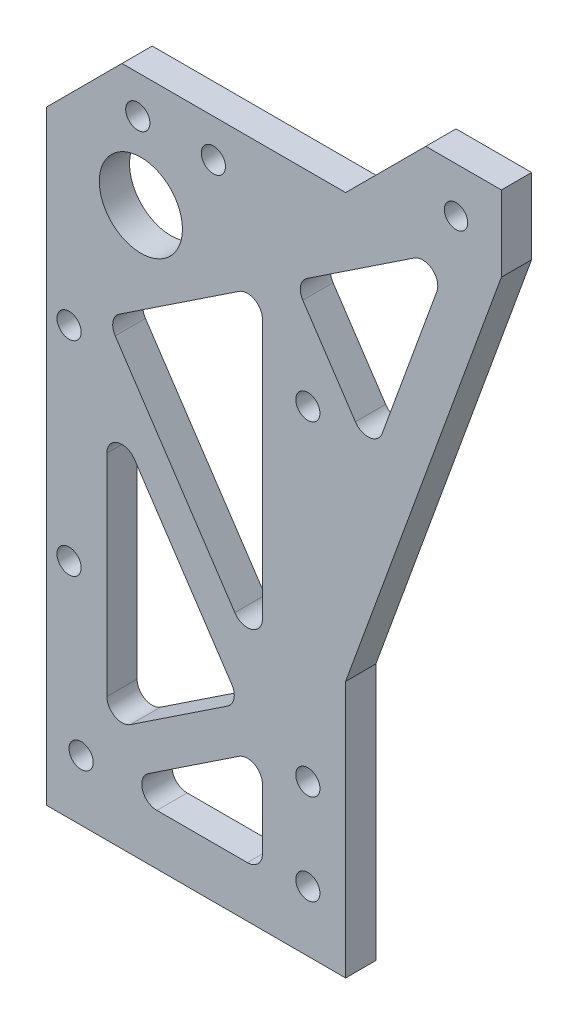
from build123d import *

# Parameters (mm, degrees)
SKETCH_1_R          = 1.6
SKETCH_1_R_2        = 6.075
EXTRUDE_1_DEPTH     = 4
CUT_EXTRUDE_1_REACH = 81.983
SKETCH_2_R          = 1.6
EXTRUDE_2_DEPTH     = 4
CUT_EXTRUDE_2_REACH = 91.192
SKETCH_5_R          = 1.55
SKETCH_6_R          = 6.075
SKETCH_6_R_2        = 5.5
EXTRUDE_3_DEPTH     = 4
CHAMFER_1_SIZE      = 10
CUT_EXTRUDE_3_DEPTH = 10


with BuildPart() as part:
    # 草图1 → 凸台-拉伸1 (new body)
    with BuildSketch(Plane.XY.offset(4)):
        Polygon((27.5, -75), (27.5, -38.070079149), (27.5, 15), (-12.093715748, 15), (-12.093715748, -75), align=None)
        with Locations((22.5, -12)):
            Circle(SKETCH_1_R, mode=Mode.SUBTRACT)
        with Locations((22.5, -55)):
            Circle(SKETCH_1_R, mode=Mode.SUBTRACT)
        with Locations((22.5, -67)):
            Circle(SKETCH_1_R, mode=Mode.SUBTRACT)
        with Locations((-7.5, -67)):
            Circle(SKETCH_1_R, mode=Mode.SUBTRACT)
        with Locations((-9.093715748, -18.5)):
            Circle(SKETCH_1_R, mode=Mode.SUBTRACT)
        with Locations((0.406284252, 0)):
            Circle(SKETCH_1_R_2, mode=Mode.SUBTRACT)
        with Locations((-9.093715748, -45.5)):
            Circle(SKETCH_1_R, mode=Mode.SUBTRACT)
        with Locations((0, 10)):
            Circle(SKETCH_1_R, mode=Mode.SUBTRACT)
    extrude(amount=-EXTRUDE_1_DEPTH)

    # 草图2 → 切除-拉伸1 (cut, up to next)
    with BuildSketch(Plane.XY.offset(4), mode=Mode.PRIVATE) as cut_extrude_1_sk1:
        with Locations((10, 10)):
            Circle(SKETCH_2_R)
    cut_extrude_1_tool1 = extrude(cut_extrude_1_sk1.sketch, amount=-CUT_EXTRUDE_1_REACH, mode=Mode.PRIVATE) & part.part
    add(cut_extrude_1_tool1.solids().sort_by_distance((10, 10, 4))[0], mode=Mode.SUBTRACT)

    # 草图3 → 凸台-拉伸2 (add)
    with BuildSketch(Plane.XY.offset(4)):
        Polygon((38.106601718, 25.606601718), (48.106601718, 25.606601718), (48.106601718, 15.606601718), (27.5, -41.009571194), (27.5, 15), align=None)
    extrude(amount=-EXTRUDE_2_DEPTH)

    # 草图5 → 切除-拉伸2 (cut, up to next)
    with BuildSketch(Plane.XY.offset(4), mode=Mode.PRIVATE) as cut_extrude_2_sk1:
        with Locations((42.106601718, 19.606601718)):
            Circle(SKETCH_5_R)
    cut_extrude_2_tool1 = extrude(cut_extrude_2_sk1.sketch, amount=-CUT_EXTRUDE_2_REACH, mode=Mode.PRIVATE) & part.part
    add(cut_extrude_2_tool1.solids().sort_by_distance((42.106602, 19.606602, 4))[0], mode=Mode.SUBTRACT)

    # 草图6 → 凸台-拉伸3 (add)
    with BuildSketch(Plane.XY.offset(4)):
        with Locations((0.406284252, 0)):
            Circle(SKETCH_6_R)
        with Locations((0.406284252, 0)):
            Circle(SKETCH_6_R_2, mode=Mode.SUBTRACT)
    extrude(amount=-EXTRUDE_3_DEPTH)

    # 倒角1
    chamfer_1_edges = [part.edges().sort_by_distance(p)[0] for p in [
        (-12.093715748, 15, 2),
    ]]
    chamfer(chamfer_1_edges, length=CHAMFER_1_SIZE)

    # 草图7 → 切除-拉伸3 (cut)
    with BuildSketch(Plane.XY.offset(4)):
        with BuildLine():
            Line((13.392547929, -3.373569554), (-2.428317925, -13.894089286))
            ThreePointArc((-2.428317925, -13.894089286), (-3.281566817, -15.164959884), (-2.986263677, -16.66693918))
            Line((-2.986263677, -16.66693918), (12.834602177, -40.458520085))
            ThreePointArc((12.834602177, -40.458520085), (15.078448076, -41.265590885), (16.5, -39.351068014))
            Line((16.5, -39.351068014), (16.5, -5.038967377))
            ThreePointArc((16.5, -5.038967377), (15.444747548, -3.276170715), (13.392547929, -3.373569554))
        make_face()
        with BuildLine():
            Line((-4.093715748, -30.650792548), (-4.093715748, -58.542420363))
            ThreePointArc((-4.093715748, -58.542420363), (-3.038463296, -60.305217024), (-0.986263677, -60.207818186))
            Line((-0.986263677, -60.207818186), (11.874205193, -51.655895822))
            ThreePointArc((11.874205193, -51.655895822), (12.727454085, -50.385025224), (12.432150945, -48.883045927))
            Line((12.432150945, -48.883045927), (-0.428317925, -29.543340476))
            ThreePointArc((-0.428317925, -29.543340476), (-2.672163824, -28.736269677), (-4.093715748, -30.650792548))
        make_face()
        with BuildLine():
            Line((13.392547929, -56.650803391), (1.418347224, -64.613377371))
            ThreePointArc((1.418347224, -64.613377371), (0.611276424, -66.85722327), (2.525799295, -68.278775194))
            Line((2.525799295, -68.278775194), (14.5, -68.278775194))
            ThreePointArc((14.5, -68.278775194), (15.914213562, -67.692988757), (16.5, -66.278775194))
            Line((16.5, -66.278775194), (16.5, -58.316201214))
            ThreePointArc((16.5, -58.316201214), (15.444747548, -56.553404552), (13.392547929, -56.650803391))
        make_face()
        with BuildLine():
            Line((21.833651172, -0.162254397), (28.786099045, -10.617417066))
            ThreePointArc((28.786099045, -10.617417066), (30.68870361, -11.495848415), (32.330882109, -10.194005281))
            Line((32.330882109, -10.194005281), (39.571402914, 9.699162134))
            ThreePointArc((39.571402914, 9.699162134), (38.92851881, 11.95516455), (36.584565601, 12.048600244))
            Line((36.584565601, 12.048600244), (22.391596924, 2.610595497))
            ThreePointArc((22.391596924, 2.610595497), (21.538348031, 1.339724899), (21.833651172, -0.162254397))
        make_face()
    extrude(amount=-CUT_EXTRUDE_3_DEPTH, mode=Mode.SUBTRACT)


solid = part.part
